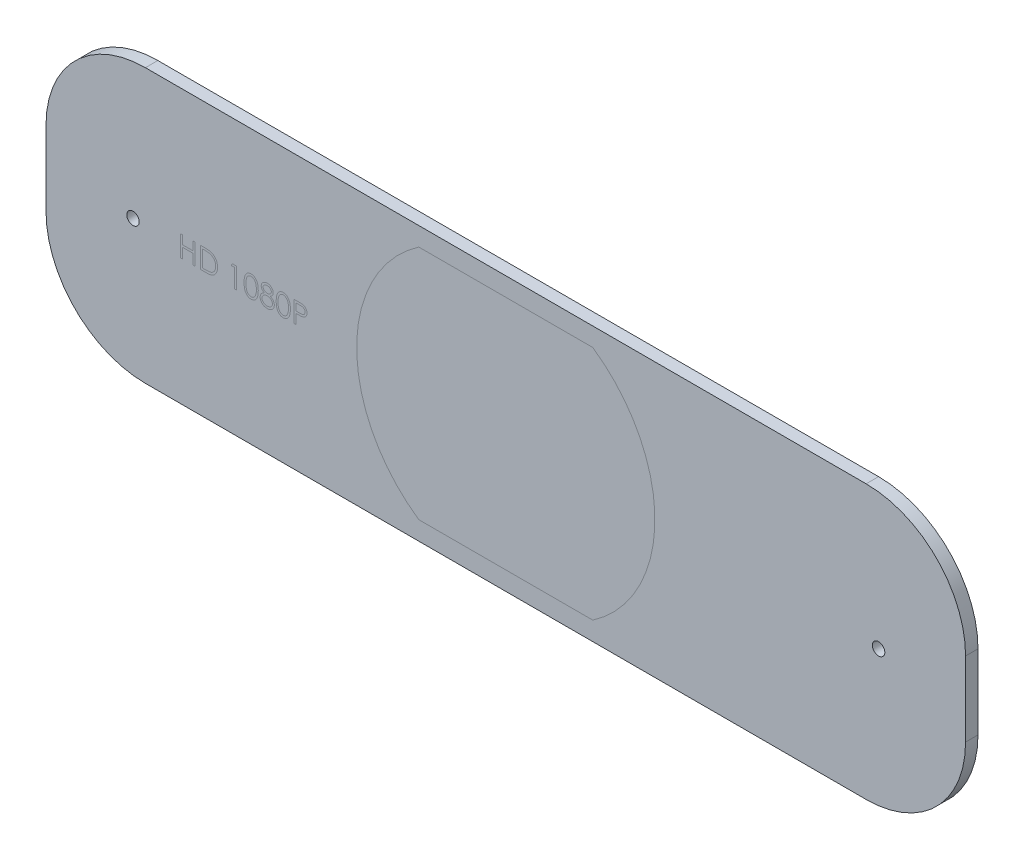
from build123d import *

# Parameters (mm, degrees)
SKETCH1_R           = 0.5
BOSS_EXTRUDE1_DEPTH = 0.5
SPLIT1_START        = -0.5
SPLIT1_DEPTH        = 1
SPLIT1_2_DEPTH      = 1


# Read off the part's stored shape, not the designer's step: Split1
with BuildPart() as part:
    # Sketch1 → Boss-Extrude1 (new, symmetric)
    with BuildSketch(Plane.XY):
        with BuildLine():
            Line((-29, 11), (29, 11))
            ThreePointArc((29, 11), (34.656854249, 8.656854249), (37, 3))
            Line((37, 3), (37, -3))
            ThreePointArc((37, -3), (34.656854249, -8.656854249), (29, -11))
            Line((29, -11), (-29, -11))
            ThreePointArc((-29, -11), (-34.656854249, -8.656854249), (-37, -3))
            Line((-37, -3), (-37, 3))
            ThreePointArc((-37, 3), (-34.656854249, 8.656854249), (-29, 11))
        make_face()
        with Locations((-30, 0)):
            Circle(SKETCH1_R, mode=Mode.SUBTRACT)
        with Locations((30, 0)):
            Circle(SKETCH1_R, mode=Mode.SUBTRACT)
    extrude(amount=BOSS_EXTRUDE1_DEPTH, both=True)

    # Split1 2 outline → Split1 2 (cut)
    with BuildSketch(Plane.XY.offset(SPLIT1_START)):
        with BuildLine():
            Line((7, 9.5), (-7, 9.5))
            ThreePointArc((-7, 9.5), (-12, 0), (-7, -9.5))
            Line((-7, -9.5), (7, -9.5))
            ThreePointArc((7, -9.5), (12, 0), (7, 9.5))
        make_face()
    extrude(amount=SPLIT1_2_DEPTH, mode=Mode.SUBTRACT)


with BuildPart() as body_2:
    # Split1 outline → Split1 (new body)
    with BuildSketch(Plane.XY.offset(SPLIT1_START)):
        with BuildLine():
            ThreePointArc((7, -9.5), (12, 0), (7, 9.5))
            Line((7, 9.5), (-7, 9.5))
            ThreePointArc((-7, 9.5), (-12, 0), (-7, -9.5))
            Line((-7, -9.5), (7, -9.5))
        make_face()
    extrude(amount=SPLIT1_DEPTH)


solid = Compound([part.part, body_2.part])
